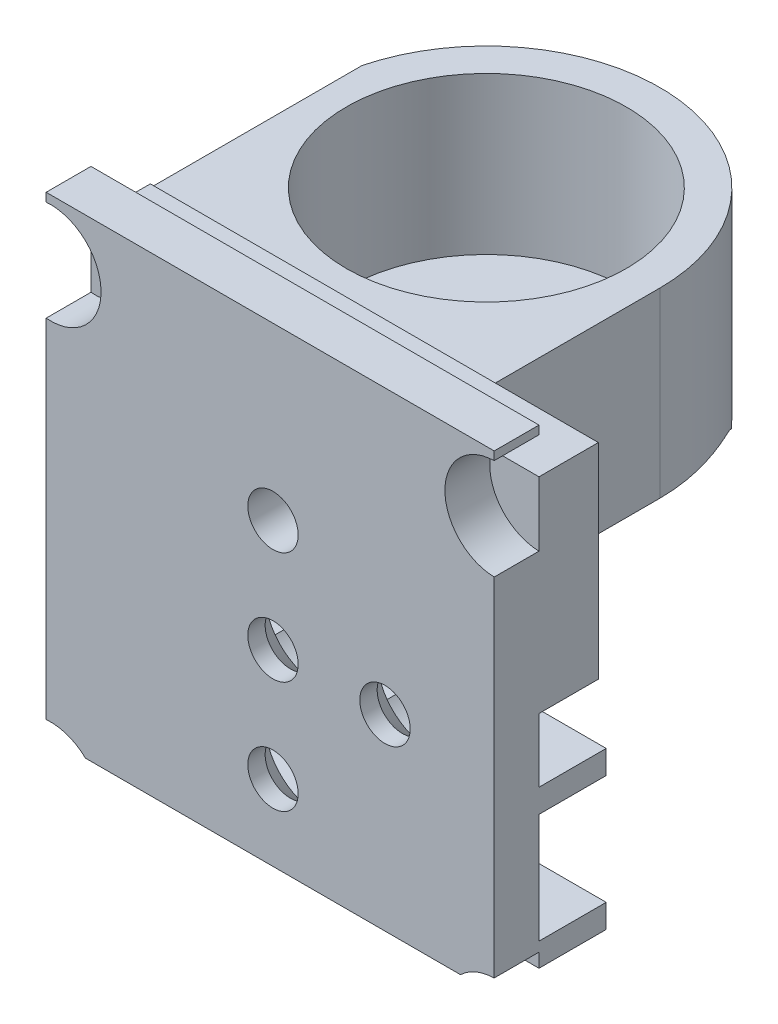
from build123d import *

# Parameters (mm, degrees)
BOSS_EXTRUDE1_START = 0.5
SKETCH1_W           = 25
SKETCH1_H           = 14
BOSS_EXTRUDE1_DEPTH = 2
SKETCH2_W           = 25
SKETCH2_H           = 2.1
BOSS_EXTRUDE2_DEPTH = 6
SKETCH3_W           = 40
SKETCH3_H           = 42
BOSS_EXTRUDE3_DEPTH = 4
BOSS_EXTRUDE5_START = -18.3
SKETCH4_2_R         = 1.5
BOSS_EXTRUDE5_DEPTH = 4
SKETCH5_W           = 40
SKETCH5_H           = 18.3
BOSS_EXTRUDE6_DEPTH = 5.3
SKETCH7_R           = 4.5
CUT_EXTRUDE1_DEPTH  = 4
SKETCH9_W           = 35.343646405
SKETCH9_H           = 8.813303651
CUT_EXTRUDE3_DEPTH  = 10
SKETCH11_R          = 12.5
SKETCH11_R_2        = 1.5
SKETCH11_R_3        = 3.55
BOSS_EXTRUDE7_DEPTH = 4
SKETCH12_R          = 12.5
BOSS_EXTRUDE8_DEPTH = 14
SKETCH13_W          = 15
SKETCH13_H          = 2.1
BOSS_EXTRUDE9_DEPTH = 6
CUT_EXTRUDE2_DEPTH  = 64.84830294
SKETCH14_W          = 6.01632357
SKETCH14_H          = 22.957747356
CUT_EXTRUDE4_DEPTH  = 64.347816028


# Read off the part's stored shape, not the designer's step: CSK for M4 Flat Head Machine Screw1
with BuildPart() as part:
    # Sketch1 → Boss-Extrude1 (new body)
    with BuildSketch(Plane.XY.offset(-1).offset(BOSS_EXTRUDE1_START)):
        with Locations((23.192657344, 4)):
            Rectangle(SKETCH1_W, SKETCH1_H)
    extrude(amount=BOSS_EXTRUDE1_DEPTH)

    # Sketch2 → Boss-Extrude2 (add)
    with BuildSketch(Plane(origin=(0, 0, -0.5), x_dir=(-1, 0, 0), z_dir=(0, 0, -1))):
        with Locations((-23.192657344, 9.95)):
            Rectangle(SKETCH2_W, SKETCH2_H)
        with Locations((-23.192657344, -1.95)):
            Rectangle(SKETCH2_W, SKETCH2_H)
    extrude(amount=BOSS_EXTRUDE2_DEPTH)

    # Sketch3 → Boss-Extrude3 (add)
    with BuildSketch(Plane(origin=(0, 0, -0.5), x_dir=(-1, 0, 0), z_dir=(0, 0, -1))):
        with Locations((-15.692657344, 18)):
            Rectangle(SKETCH3_W, SKETCH3_H)
    extrude(amount=-BOSS_EXTRUDE3_DEPTH)

    # Sketch4<2> → Boss-Extrude5 (add)
    with BuildSketch(Plane(origin=(0, 35, 0), x_dir=(1, 0, 0), z_dir=(0, 1, 0)).offset(BOSS_EXTRUDE5_START)):
        with BuildLine():
            Line((-1.349302764, 24.5), (-1.349302764, 0.5))
            Line((-1.349302764, 0.5), (8.650697236, 0.5))
            Line((8.650697236, 0.5), (8.650697236, 24.5))
            ThreePointArc((8.650697236, 24.5), (3.650697236, 29.5), (-1.349302764, 24.5))
        make_face()
        with Locations(Location((3.650697236, 7.5, 0), (0, 0, 270))):
            Circle(SKETCH4_2_R, mode=Mode.SUBTRACT)
        with Locations(Location((3.650697236, 24.5, 0), (0, 0, 270))):
            Circle(SKETCH4_2_R, mode=Mode.SUBTRACT)
    extrude(amount=-BOSS_EXTRUDE5_DEPTH)

    # Sketch5 → Boss-Extrude6 (add)
    with BuildSketch(Plane(origin=(0, 0, -0.5), x_dir=(-1, 0, 0), z_dir=(0, 0, -1))):
        with Locations((-15.692657344, 25.85)):
            Rectangle(SKETCH5_W, SKETCH5_H)
    extrude(amount=BOSS_EXTRUDE6_DEPTH)

    # CSK for M4 Flat Head Machine Screw1 outl → CSK for M4 Flat Head Machine Screw1 (revolve, cut)
    with BuildSketch(Plane(origin=(15.942657344, 23.75, 0), x_dir=(1, 0, 0), z_dir=(0, -1, 0))):
        Polygon((2.25, -3.35), (2.25, 3.5), (0, 3.5), (0, -5.8), (4.7, -5.8), align=None)
    revolve(axis=Axis((15.942657344, 23.75, 0), (0, 0, 1)), mode=Mode.SUBTRACT)

    # CSK for M4 Flat Head Machine Screw1 2 ou → CSK for M4 Flat Head Machine Screw1 2 (revolve, cut)
    with BuildSketch(Plane(origin=(15.942657344, 3.75, 0), x_dir=(1, 0, 0), z_dir=(0, -1, 0))):
        Polygon((4.7, -0.5), (2.25, 1.95), (2.25, 3.5), (0, 3.5), (0, -0.5), align=None)
    revolve(axis=Axis((15.942657344, 3.75, 0), (0, 0, 1)), mode=Mode.SUBTRACT)

    # CSK for M4 Flat Head Machine Screw1 3 ou → CSK for M4 Flat Head Machine Screw1 3 (revolve, cut)
    with BuildSketch(Plane(origin=(15.942657344, 13.75, 0), x_dir=(1, 0, 0), z_dir=(0, -1, 0))):
        Polygon((4.7, -0.5), (2.25, 1.95), (2.25, 3.5), (0, 3.5), (0, -0.5), align=None)
    revolve(axis=Axis((15.942657344, 13.75, 0), (0, 0, 1)), mode=Mode.SUBTRACT)

    # CSK for M4 Flat Head Machine Screw1 4 ou → CSK for M4 Flat Head Machine Screw1 4 (revolve, cut)
    with BuildSketch(Plane(origin=(25.942657344, 13.75, 0), x_dir=(1, 0, 0), z_dir=(0, -1, 0))):
        Polygon((2.25, 1.95), (2.25, 3.5), (0, 3.5), (0, -0.5), (4.7, -0.5), align=None)
    revolve(axis=Axis((25.942657344, 13.75, 0), (0, 0, 1)), mode=Mode.SUBTRACT)

    # Sketch7 → Cut-Extrude1 (cut)
    with BuildSketch(Plane(origin=(0, 0, 3.5), x_dir=(-1, 0, 0), z_dir=(0, 0, -1))):
        with Locations((-35.792657344, 33.75)):
            Circle(SKETCH7_R)
        with Locations((3.907342656, 33.75)):
            Circle(SKETCH7_R)
        with Locations((3.907342656, -6.25)):
            Circle(SKETCH7_R)
        with Locations((-35.792657344, -6.25)):
            Circle(SKETCH7_R)
    extrude(amount=CUT_EXTRUDE1_DEPTH, mode=Mode.SUBTRACT)

    # Sketch9 → Cut-Extrude3 (cut)
    with BuildSketch(Plane.ZY.offset(1.349302764)):
        with Locations((-18.171823203, 12.293348175)):
            Rectangle(SKETCH9_W, SKETCH9_H)
    extrude(amount=-CUT_EXTRUDE3_DEPTH, mode=Mode.SUBTRACT)

    # Sketch11 → Boss-Extrude7 (add)
    # profile 1 of 4: a face of its own
    with BuildSketch(Plane.XZ.offset(-16.7)):
        with BuildLine():
            Line((6.787532506, -5.8), (-4.307342656, -5.8))
            Line((-4.307342656, -5.8), (-4.807342656, -5.8))
            Line((-4.807342656, -5.8), (-4.807342656, -20.8))
            ThreePointArc((-4.807342656, -20.8), (-1.570691199, -11.320533638), (6.787532506, -5.8))
        make_face()
    # profile 2 of 4: a face of its own
    with BuildSketch(Plane.XZ.offset(-16.7)):
        with BuildLine():
            Line((14.597782182, -5.8), (6.787532506, -5.8))
            ThreePointArc((6.787532506, -5.8), (-1.570691199, -11.320533638), (-4.807342656, -20.8))
            ThreePointArc((-4.807342656, -20.8), (10.692657344, -36.3), (26.192657344, -20.8))
            ThreePointArc((26.192657344, -20.8), (22.956005887, -11.320533638), (14.597782182, -5.8))
        make_face()
        with Locations((10.692657344, -20.8)):
            Circle(SKETCH11_R, mode=Mode.SUBTRACT)
    # profile 3 of 4: a face of its own
    with BuildSketch(Plane.XZ.offset(-16.7)):
        with Locations((10.692657344, -20.8)):
            Circle(SKETCH11_R)
        with Locations(Location((10.692657344, -12.3, 0), (0, 0, 270))):
            Circle(SKETCH11_R_2, mode=Mode.SUBTRACT)
        with Locations(Location((10.692657344, -20.8, 0), (0, 0, 270))):
            Circle(SKETCH11_R_3, mode=Mode.SUBTRACT)
        with Locations(Location((19.192657344, -20.8, 0), (0, 0, 270))):
            Circle(SKETCH11_R_2, mode=Mode.SUBTRACT)
        with Locations(Location((10.692657344, -29.3, 0), (0, 0, 270))):
            Circle(SKETCH11_R_2, mode=Mode.SUBTRACT)
        with Locations(Location((2.192657344, -20.8, 0), (0, 0, 270))):
            Circle(SKETCH11_R_2, mode=Mode.SUBTRACT)
    # profile 4 of 4: a face of its own
    with BuildSketch(Plane.XZ.offset(-16.7)):
        with BuildLine():
            Line((26.192657344, -5.8), (14.597782182, -5.8))
            ThreePointArc((14.597782182, -5.8), (22.956005887, -11.320533638), (26.192657344, -20.8))
            Line((26.192657344, -20.8), (26.192657344, -5.8))
        make_face()
    extrude(amount=-BOSS_EXTRUDE7_DEPTH)

    # Sketch12 → Boss-Extrude8 (add)
    # profile 1 of 3: a face of its own
    with BuildSketch(Plane(origin=(0, 20.7, 0), x_dir=(1, 0, 0), z_dir=(0, 1, 0))):
        with BuildLine():
            ThreePointArc((26.192657344, 20.8), (10.692657344, 36.3), (-4.807342656, 20.8))
            ThreePointArc((-4.807342656, 20.8), (-1.570691199, 11.320533638), (6.787532506, 5.8))
            Line((6.787532506, 5.8), (12.366695935, 5.8))
            Line((12.366695935, 5.8), (14.597782182, 5.8))
            ThreePointArc((14.597782182, 5.8), (22.956005887, 11.320533638), (26.192657344, 20.8))
        make_face()
        with Locations(Location((10.692657344, 20.8, 0), (0, 0, 270))):
            Circle(SKETCH12_R, mode=Mode.SUBTRACT)
    # profile 2 of 3: a face of its own
    with BuildSketch(Plane(origin=(0, 20.7, 0), x_dir=(1, 0, 0), z_dir=(0, 1, 0))):
        with BuildLine():
            Line((-4.807342656, 20.8), (-4.807342656, 5.8))
            Line((-4.807342656, 5.8), (-4.307342656, 5.8))
            Line((-4.307342656, 5.8), (6.787532506, 5.8))
            ThreePointArc((6.787532506, 5.8), (-1.570691199, 11.320533638), (-4.807342656, 20.8))
        make_face()
    # profile 3 of 3: a face of its own
    with BuildSketch(Plane(origin=(0, 20.7, 0), x_dir=(1, 0, 0), z_dir=(0, 1, 0))):
        with BuildLine():
            Line((26.192657344, 5.8), (26.192657344, 20.8))
            ThreePointArc((26.192657344, 20.8), (22.956005887, 11.320533638), (14.597782182, 5.8))
            Line((14.597782182, 5.8), (19.518618753, 5.8))
            Line((19.518618753, 5.8), (26.192657344, 5.8))
        make_face()
    extrude(amount=BOSS_EXTRUDE8_DEPTH)

    # Sketch13 → Boss-Extrude9 (add)
    with BuildSketch(Plane(origin=(0, 0, -0.5), x_dir=(-1, 0, 0), z_dir=(0, 0, -1))):
        with Locations((-3.192657344, 9.95)):
            Rectangle(SKETCH13_W, SKETCH13_H)
        with Locations((-3.192657344, -1.95)):
            Rectangle(SKETCH13_W, SKETCH13_H)
    extrude(amount=BOSS_EXTRUDE9_DEPTH)

    # Sketch8 → Cut-Extrude2 (cut, through all)
    with BuildSketch(Plane(origin=(0, 0, -0.5), x_dir=(-1, 0, 0), z_dir=(0, 0, -1))):
        with BuildLine():
            ThreePointArc((-12.283764069, 16.7), (-15.942657344, 18.45), (-19.601550619, 16.7))
            ThreePointArc((-19.601550619, 16.7), (-20.640973864, 13.875785056), (-19.754153113, 11))
            ThreePointArc((-19.754153113, 11), (-15.942657344, 9.05), (-12.131161575, 11))
            ThreePointArc((-12.131161575, 11), (-11.244340824, 13.875785056), (-12.283764069, 16.7))
        make_face()
        with BuildLine():
            ThreePointArc((-22.283764069, 16.7), (-25.942657344, 18.45), (-29.601550619, 16.7))
            ThreePointArc((-29.601550619, 16.7), (-30.640973864, 13.875785056), (-29.754153113, 11))
            ThreePointArc((-29.754153113, 11), (-25.942657344, 9.05), (-22.131161575, 11))
            ThreePointArc((-22.131161575, 11), (-21.244340824, 13.875785056), (-22.283764069, 16.7))
        make_face()
    extrude(amount=CUT_EXTRUDE2_DEPTH, mode=Mode.SUBTRACT)

    # Sketch14 → Cut-Extrude4 (cut, through all)
    with BuildSketch(Plane(origin=(0, 34.7, 0), x_dir=(1, 0, 0), z_dir=(0, 1, 0))):
        with Locations((-7.315504441, 17.278873678)):
            Rectangle(SKETCH14_W, SKETCH14_H)
    extrude(amount=-CUT_EXTRUDE4_DEPTH, mode=Mode.SUBTRACT)


solid = part.part
